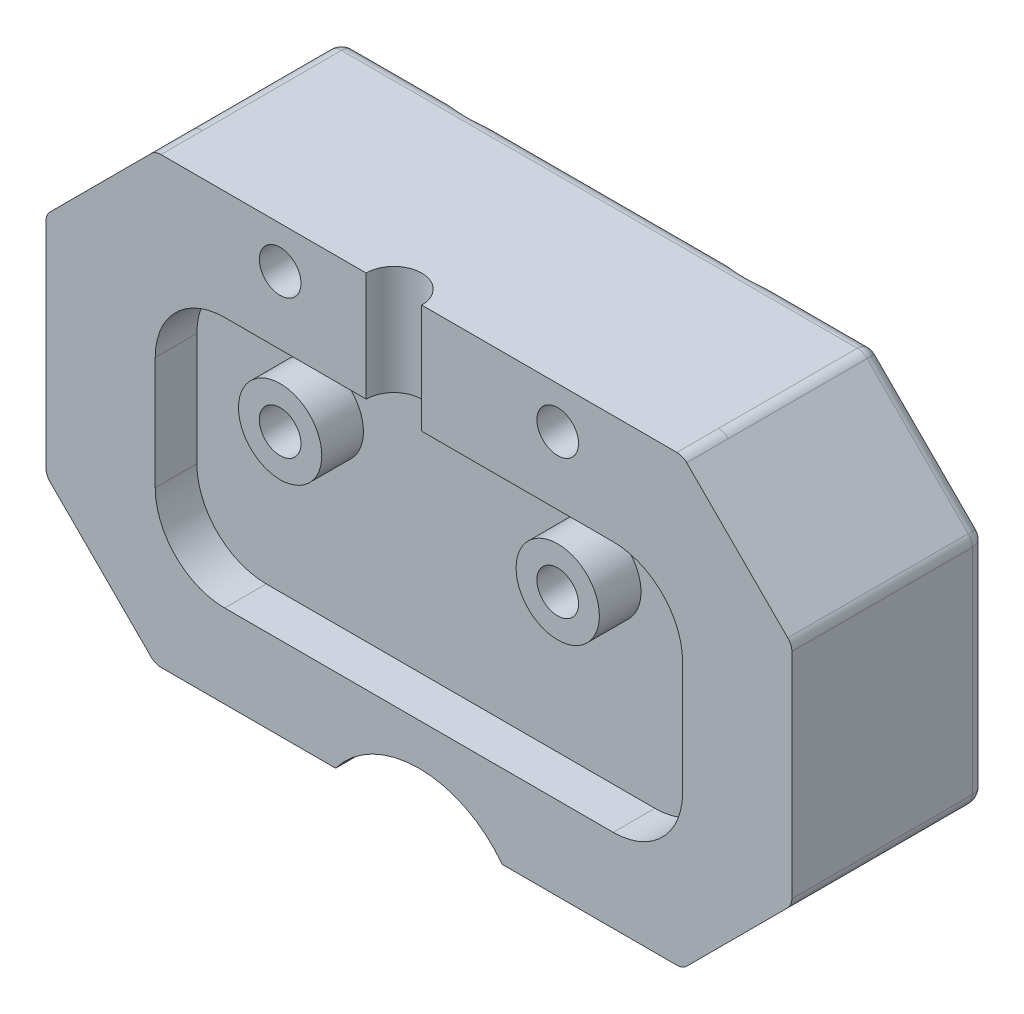
from build123d import *

# Parameters (mm, degrees)
CROQUIS3_W                   = 38
CROQUIS3_H                   = 38
SALIENTE_EXTRUIR9_DEPTH      = 1
SALIENTE_EXTRUIR10_START     = -11
SALIENTE_EXTRUIR10_OUTLINE_W = 38
SALIENTE_EXTRUIR10_OUTLINE_H = 38
SALIENTE_EXTRUIR10_DEPTH     = 10
CROQUIS13_W                  = 38
CROQUIS13_H                  = 38
SALIENTE_EXTRUIR15_DEPTH     = 3
CROQUIS14_R                  = 1.5
CORTAR_EXTRUIR1_DEPTH        = 14
CROQUIS15_W                  = 38
CROQUIS15_H                  = 24.129942315
CROQUIS15_R                  = 3.5
SALIENTE_EXTRUIR16_DEPTH     = 1
CORTAR_EXTRUIR2_DEPTH        = 14
SALIENTE_EXTRUIR17_DEPTH     = 5
SALIENTE_EXTRUIR18_DEPTH     = 5
CORTAR_EXTRUIR3_DEPTH        = 3
REDONDEO11_R                 = 1
CROQUIS21_R                  = 1.5
CORTAR_EXTRUIR4_DEPTH        = 11
SALIENTE_EXTRUIR20_START     = 3
CROQUIS22_R                  = 3
CROQUIS22_R_2                = 1.5
SALIENTE_EXTRUIR20_DEPTH     = 3
CHAFL_N1_SIZE                = 2
REDONDEO12_R                 = 1
REDONDEO13_R                 = 1
SALIENTE_EXTRUIR22_DEPTH     = 3
REDONDEO14_R                 = 5
SALIENTE_EXTRUIR23_DEPTH     = 8


# Read off the part's stored shape, not the designer's step: Saliente-Extruir10
with BuildPart() as part:
    # Croquis3 → Saliente-Extruir9 (new body)
    with BuildSketch(Plane.XY.offset(5)):
        Polygon((19, -5.370057685), (26.870057685, 2.5), (26.870057685, 40.5), (19, 48.370057685), (-19, 48.370057685), (-26.870057685, 40.5), (-26.870057685, 2.5), (-19, -5.370057685), align=None)
        with Locations((0, 21.5)):
            Rectangle(CROQUIS3_W, CROQUIS3_H, mode=Mode.SUBTRACT)
    extrude(amount=-SALIENTE_EXTRUIR9_DEPTH)

    # Saliente-Extruir10 outline → Saliente-Extruir10 (add)
    with BuildSketch(Plane(origin=(0, 0, 4), x_dir=(-1, 0, 0), z_dir=(0, 0, -1)).offset(SALIENTE_EXTRUIR10_START)):
        Polygon((-26.870057685, 2.5), (-19, -5.370057685), (19, -5.370057685), (26.870057685, 2.5), (26.870057685, 40.5), (19, 48.370057685), (-19, 48.370057685), (-26.870057685, 40.5), align=None)
        with Locations((0, 21.5)):
            Rectangle(SALIENTE_EXTRUIR10_OUTLINE_W, SALIENTE_EXTRUIR10_OUTLINE_H, mode=Mode.SUBTRACT)
    extrude(amount=SALIENTE_EXTRUIR10_DEPTH)

    # Croquis13 → Saliente-Extruir15 (add)
    with BuildSketch(Plane.XY.offset(15)):
        with BuildLine():
            Line((-22.5, 44.870057685), (-22.5, -1))
            Line((-22.5, -1), (22.5, -1))
            Line((22.5, -1), (22.5, 44.870057685))
            Line((22.5, 44.870057685), (19.292893219, 48.077164466))
            ThreePointArc((19.292893219, 48.077164466), (18.96846987, 48.293937218), (18.585786438, 48.370057685))
            Line((18.585786438, 48.370057685), (-18.585786438, 48.370057685))
            ThreePointArc((-18.585786438, 48.370057685), (-18.96846987, 48.293937218), (-19.292893219, 48.077164466))
            Line((-19.292893219, 48.077164466), (-22.5, 44.870057685))
        make_face()
        with Locations((0, 21.5)):
            Rectangle(CROQUIS13_W, CROQUIS13_H, mode=Mode.SUBTRACT)
    extrude(amount=SALIENTE_EXTRUIR15_DEPTH)

    # Croquis14 → Cortar-Extruir1 (cut)
    with BuildSketch(Plane(origin=(0, 0, 4), x_dir=(-1, 0, 0), z_dir=(0, 0, -1))):
        with Locations((10, 45.37415474)):
            Circle(CROQUIS14_R)
        with Locations(Location((-10, 45.37415474, 0), (0, 0, 180))):
            Circle(CROQUIS14_R)
    extrude(amount=-CORTAR_EXTRUIR1_DEPTH, mode=Mode.SUBTRACT)

    # Croquis15 → Saliente-Extruir16 (add)
    with BuildSketch(Plane(origin=(0, 0, 4), x_dir=(-1, 0, 0), z_dir=(0, 0, -1))):
        with Locations((0, 28.435028843)):
            Rectangle(CROQUIS15_W, CROQUIS15_H)
        with Locations((0, 25.370057685)):
            Circle(CROQUIS15_R, mode=Mode.SUBTRACT)
    extrude(amount=-SALIENTE_EXTRUIR16_DEPTH)

    # Croquis16 → Cortar-Extruir2 (cut)
    with BuildSketch(Plane(origin=(0, 0, 4), x_dir=(-1, 0, 0), z_dir=(0, 0, -1))):
        Polygon((-19, 2.5), (-19, 16.370057685), (-26.870057685, 24.24011537), (-26.870057685, 2.5), (-19, -5.370057685), (19, -5.370057685), (26.870057685, 2.5), (26.870057685, 24.24011537), (19, 16.370057685), (19, 2.5), align=None)
    extrude(amount=-CORTAR_EXTRUIR2_DEPTH, mode=Mode.SUBTRACT)

    # Croquis17 → Saliente-Extruir17 (add)
    with BuildSketch(Plane.XY.offset(5)):
        Polygon((6, 31.370057685), (6, 25.370057685), (6, 19.370057685), (6, 16.370057685), (19, 16.370057685), (19, 40.5), (-19, 40.5), (-19, 16.370057685), (-6, 16.370057685), (-6, 19.370057685), (-6, 31.370057685), align=None)
    extrude(amount=SALIENTE_EXTRUIR17_DEPTH)

    # Croquis18 → Saliente-Extruir18 (add)
    with BuildSketch(Plane.XY.offset(10)):
        Polygon((-19, 40.5), (-19, 16.370057685), (-6, 16.370057685), (-6, 19.370057685), (6, 19.370057685), (6, 16.370057685), (19, 16.370057685), (19, 40.5), align=None)
    extrude(amount=SALIENTE_EXTRUIR18_DEPTH)

    # Croquis19 → Cortar-Extruir3 (cut)
    with BuildSketch(Plane.XY.offset(18)):
        Polygon((-22.5, 19.870057685), (-19, 16.370057685), (-19, 21.370057685), (-22.5, 21.370057685), align=None)
        Polygon((19, 16.370057685), (22.5, 19.870057685), (22.5, 21.370057685), (19, 21.370057685), align=None)
    extrude(amount=-CORTAR_EXTRUIR3_DEPTH, mode=Mode.SUBTRACT)

    # Redondeo11
    redondeo11_edges = [part.edges().sort_by_distance(p)[0] for p in [
        (26.870057685, 40.5, 10),
        (19, 48.370057685, 10),
        (-19, 48.370057685, 10),
        (-26.870057685, 40.5, 10),
        (26.870057685, 24.24011537, 9.5),
        (19, 16.370057685, 9.5),
        (-26.870057685, 24.24011537, 9.5),
        (-19, 16.370057685, 9.5),
    ]]
    fillet(redondeo11_edges, radius=REDONDEO11_R)

    # Croquis21 → Cortar-Extruir4 (cut)
    with BuildSketch(Plane.XY.offset(15)):
        with Locations((-10, 35.37415474)):
            Circle(CROQUIS21_R)
        with Locations((10, 35.37415474)):
            Circle(CROQUIS21_R)
    extrude(amount=-CORTAR_EXTRUIR4_DEPTH, mode=Mode.SUBTRACT)

    # Croquis22 → Saliente-Extruir20 (add)
    # profile 1 of 2: a face of its own
    with BuildSketch(Plane.XY.offset(15).offset(SALIENTE_EXTRUIR20_START)):
        with Locations(Location((-10, 35.37415474, 0), (0, 0, 180))):
            Circle(CROQUIS22_R)
        with Locations((-10, 35.37415474)):
            Circle(CROQUIS22_R_2, mode=Mode.SUBTRACT)
    # profile 2 of 2: a face of its own
    with BuildSketch(Plane.XY.offset(15).offset(SALIENTE_EXTRUIR20_START)):
        with Locations(Location((10, 35.37415474, 0), (0, 0, 180))):
            Circle(CROQUIS22_R)
        with Locations((10, 35.37415474)):
            Circle(CROQUIS22_R_2, mode=Mode.SUBTRACT)
    extrude(amount=-SALIENTE_EXTRUIR20_DEPTH)

    # Croquis23 → Cortar-Revolución1 (revolve, cut)
    with BuildSketch(Plane.XY.offset(18)):
        Polygon((-1.8, 48.370057685), (-1.8, 44.97415474), (-1.8, 40.5), (0.2, 40.5), (0.2, 48.370057685), align=None)
    revolve(axis=Axis((-1.8, 44.97415474, 18), (0, 1, 0)), mode=Mode.SUBTRACT)

    # Chaflán1
    # the kernel refuses this chamfer: 2 mm, written as the material it takes off along each edge
    with BuildSketch(Plane(origin=(-10, 45.37415474, 4), x_dir=(-1, 0, 0), z_dir=(0, -1, 0))) as chafl_n1_piece_1:
        Polygon((1.5 + CHAFL_N1_SIZE, 0), (1.5, -CHAFL_N1_SIZE), (1.5, 0), align=None)
    revolve(axis=Axis((-10, 45.37415474, 4), (0, 0, -1)), mode=Mode.SUBTRACT)
    with BuildSketch(Plane(origin=(10, 45.37415474, 4), x_dir=(1, 0, 0), z_dir=(0, 1, 0))) as chafl_n1_piece_2:
        Polygon((1.5 + CHAFL_N1_SIZE, 0), (1.5, -CHAFL_N1_SIZE), (1.5, 0), align=None)
    revolve(axis=Axis((10, 45.37415474, 4), (0, 0, -1)), mode=Mode.SUBTRACT)
    with BuildSketch(Plane(origin=(-10, 35.37415474, 4), x_dir=(1, 0, 0), z_dir=(0, -1, 0))) as chafl_n1_piece_3:
        Polygon((1.5 + CHAFL_N1_SIZE, 0), (1.5, CHAFL_N1_SIZE), (1.5, 0), align=None)
    revolve(axis=Axis((-10, 35.37415474, 4), (0, 0, 1)), mode=Mode.SUBTRACT)
    with BuildSketch(Plane(origin=(10, 35.37415474, 4), x_dir=(1, 0, 0), z_dir=(0, -1, 0))) as chafl_n1_piece_4:
        Polygon((1.5 + CHAFL_N1_SIZE, 0), (1.5, CHAFL_N1_SIZE), (1.5, 0), align=None)
    revolve(axis=Axis((10, 35.37415474, 4), (0, 0, 1)), mode=Mode.SUBTRACT)

    # Redondeo12
    # the kernel refuses this fillet: 1 mm, written as the material it takes off along each edge
    with BuildSketch(Plane(origin=(26.870057685, 24.654328933, 4), x_dir=(-1, 0, 0), z_dir=(0, 1, 0)), Plane(origin=(-26.870057685, 40.085786438, 4), x_dir=(1, 0, 0), z_dir=(0, -1, 0))) as redondeo12_piece_1:
        with BuildLine():
            CenterArc((REDONDEO12_R, REDONDEO12_R), REDONDEO12_R, 180, 90)
            Line((0, REDONDEO12_R), (0, 0))
            Line((0, 0), (REDONDEO12_R, 0))
        make_face()
    extrude(amount=15.431457505, mode=Mode.SUBTRACT)
    with BuildSketch(Plane(origin=(26.577164466, 40.792893219, 4), x_dir=(-0.7071067811865461, -0.707106781186549, 0), z_dir=(-0.707106781186549, 0.7071067811865461, 0)), Plane(origin=(-26.577164466, 23.947222151, 4), x_dir=(0.7071067811865487, 0.7071067811865465, 0), z_dir=(0.7071067811865465, -0.7071067811865487, 0)), Plane(origin=(-19.292893219, 48.077164466, 4), x_dir=(0.7071067811865487, -0.7071067811865465, 0), z_dir=(-0.7071067811865465, -0.7071067811865487, 0)), Plane(origin=(19.292893219, 16.662950904, 4), x_dir=(-0.7071067811865485, 0.7071067811865467, 0), z_dir=(0.7071067811865466, 0.7071067811865485, 0))) as redondeo12_piece_2:
        with BuildLine():
            CenterArc((REDONDEO12_R, REDONDEO12_R), REDONDEO12_R, 180, 90)
            Line((0, REDONDEO12_R), (0, 0))
            Line((0, 0), (REDONDEO12_R, 0))
        make_face()
    extrude(amount=10.30151519, mode=Mode.SUBTRACT)
    with BuildSketch(Plane(origin=(18.585786438, 48.370057685, 4), x_dir=(0, -1, 0), z_dir=(-1, 0, 0)), Plane(origin=(-9.309576067, 48.370057685, 4), x_dir=(0, -1, 0), z_dir=(-1, 0, 0))) as redondeo12_piece_3:
        with BuildLine():
            CenterArc((REDONDEO12_R, REDONDEO12_R), REDONDEO12_R, 180, 90)
            Line((0, REDONDEO12_R), (0, 0))
            Line((0, 0), (REDONDEO12_R, 0))
        make_face()
    extrude(amount=9.276210371, mode=Mode.SUBTRACT)
    with BuildSketch(Plane(origin=(18.585786438, 16.370057685, 4), x_dir=(0, 1, 0), z_dir=(-1, 0, 0))) as redondeo12_piece_4:
        with BuildLine():
            CenterArc((REDONDEO12_R, -REDONDEO12_R), REDONDEO12_R, 90, 90)
            Line((0, -REDONDEO12_R), (0, 0))
            Line((0, 0), (REDONDEO12_R, 0))
        make_face()
    extrude(amount=37.171572875, mode=Mode.SUBTRACT)
    with BuildSketch(Plane(origin=(-18.585786438, 17.370057685, 4), x_dir=(-0.7071067811865493, -0.7071067811865458, 0), z_dir=(-0.7071067811865458, 0.7071067811865493, 0))) as redondeo12_piece_5:
        with BuildLine():
            CenterArc((1 - REDONDEO12_R, REDONDEO12_R), REDONDEO12_R, 270, 90)
            Line((1, REDONDEO12_R), (1, 0))
            Line((1, 0), (1 - REDONDEO12_R, 0))
        make_face()
    revolve(axis=Axis((-18.585786438, 17.370057685, 4), (0, 0, 1)), revolution_arc=45, mode=Mode.SUBTRACT)
    with BuildSketch(Plane(origin=(-25.870057685, 24.654328933, 4), x_dir=(-1, 0, 0), z_dir=(0, 1, 0))) as redondeo12_piece_6:
        with BuildLine():
            CenterArc((1 - REDONDEO12_R, REDONDEO12_R), REDONDEO12_R, 270, 90)
            Line((1, REDONDEO12_R), (1, 0))
            Line((1, 0), (1 - REDONDEO12_R, 0))
        make_face()
    revolve(axis=Axis((-25.870057685, 24.654328933, 4), (0, 0, 1)), revolution_arc=45, mode=Mode.SUBTRACT)
    with BuildSketch(Plane(origin=(18.585786438, 17.370057685, 4), x_dir=(0, -1, 0), z_dir=(-1, 0, 0))) as redondeo12_piece_7:
        with BuildLine():
            CenterArc((1 - REDONDEO12_R, REDONDEO12_R), REDONDEO12_R, 270, 90)
            Line((1, REDONDEO12_R), (1, 0))
            Line((1, 0), (1 - REDONDEO12_R, 0))
        make_face()
    revolve(axis=Axis((18.585786438, 17.370057685, 4), (0, 0, 1)), revolution_arc=45, mode=Mode.SUBTRACT)
    with BuildSketch(Plane(origin=(25.870057685, 24.654328933, 4), x_dir=(1, 0, 0), z_dir=(0, 1, 0))) as redondeo12_piece_8:
        with BuildLine():
            CenterArc((1 - REDONDEO12_R, -REDONDEO12_R), REDONDEO12_R, 0, 90)
            Line((1, -REDONDEO12_R), (1, 0))
            Line((1, 0), (1 - REDONDEO12_R, 0))
        make_face()
    revolve(axis=Axis((25.870057685, 24.654328933, 4), (0, 0, -1)), revolution_arc=45, mode=Mode.SUBTRACT)
    with BuildSketch(Plane(origin=(-25.870057685, 40.085786438, 4), x_dir=(-0.7071067811865493, 0.7071067811865458, 0), z_dir=(0.7071067811865458, 0.7071067811865493, 0))) as redondeo12_piece_9:
        with BuildLine():
            CenterArc((1 - REDONDEO12_R, REDONDEO12_R), REDONDEO12_R, 270, 90)
            Line((1, REDONDEO12_R), (1, 0))
            Line((1, 0), (1 - REDONDEO12_R, 0))
        make_face()
    revolve(axis=Axis((-25.870057685, 40.085786438, 4), (0, 0, 1)), revolution_arc=45, mode=Mode.SUBTRACT)
    with BuildSketch(Plane(origin=(-18.585786438, 47.370057685, 4), x_dir=(0, 1, 0), z_dir=(1, 0, 0))) as redondeo12_piece_10:
        with BuildLine():
            CenterArc((1 - REDONDEO12_R, REDONDEO12_R), REDONDEO12_R, 270, 90)
            Line((1, REDONDEO12_R), (1, 0))
            Line((1, 0), (1 - REDONDEO12_R, 0))
        make_face()
    revolve(axis=Axis((-18.585786438, 47.370057685, 4), (0, 0, 1)), revolution_arc=45, mode=Mode.SUBTRACT)
    with BuildSketch(Plane(origin=(18.585786438, 47.370057685, 4), x_dir=(0.7071067811865476, 0.7071067811865476, 0), z_dir=(0.7071067811865476, -0.7071067811865476, 0))) as redondeo12_piece_11:
        with BuildLine():
            CenterArc((1 - REDONDEO12_R, REDONDEO12_R), REDONDEO12_R, 270, 90)
            Line((1, REDONDEO12_R), (1, 0))
            Line((1, 0), (1 - REDONDEO12_R, 0))
        make_face()
    revolve(axis=Axis((18.585786438, 47.370057685, 4), (0, 0, 1)), revolution_arc=45, mode=Mode.SUBTRACT)
    with BuildSketch(Plane(origin=(25.870057685, 40.085786438, 4), x_dir=(1, 0, 0), z_dir=(0, -1, 0))) as redondeo12_piece_12:
        with BuildLine():
            CenterArc((1 - REDONDEO12_R, REDONDEO12_R), REDONDEO12_R, 270, 90)
            Line((1, REDONDEO12_R), (1, 0))
            Line((1, 0), (1 - REDONDEO12_R, 0))
        make_face()
    revolve(axis=Axis((25.870057685, 40.085786438, 4), (0, 0, 1)), revolution_arc=45, mode=Mode.SUBTRACT)
    with BuildSketch(Plane(origin=(10.690423933, 48.370057685, 4), x_dir=(0, -1, 0), z_dir=(-1, 0, 0))) as redondeo12_piece_13:
        with BuildLine():
            CenterArc((REDONDEO12_R, REDONDEO12_R), REDONDEO12_R, 180, 90)
            Line((0, REDONDEO12_R), (0, 0))
            Line((0, 0), (REDONDEO12_R, 0))
        make_face()
    extrude(amount=21.380847867, mode=Mode.SUBTRACT)

    # Redondeo13
    redondeo13_edges = [part.edges().sort_by_distance(p)[0] for p in [
        (22.5, 21.370057685, 16.5),
        (19, 21.370057685, 16.5),
        (-19, 21.370057685, 16.5),
        (-22.5, 21.370057685, 16.5),
    ]]
    fillet(redondeo13_edges, radius=REDONDEO13_R)

    # Croquis26 → Saliente-Extruir22 (add)
    with BuildSketch(Plane.XY.offset(15)):
        with BuildLine():
            Line((19, 22.370057685), (-19, 22.370057685))
            ThreePointArc((-19, 22.370057685), (-19.292893219, 21.662950904), (-20, 21.370057685))
            Line((-20, 21.370057685), (-21.5, 21.370057685))
            ThreePointArc((-21.5, 21.370057685), (-22.207106781, 21.662950904), (-22.5, 22.370057685))
            Line((-22.5, 22.370057685), (-22.5, 44.870057685))
            Line((-22.5, 44.870057685), (-26.577164466, 40.792893219))
            ThreePointArc((-26.577164466, 40.792893219), (-26.793937218, 40.46846987), (-26.870057685, 40.085786438))
            Line((-26.870057685, 40.085786438), (-26.870057685, 24.654328933))
            ThreePointArc((-26.870057685, 24.654328933), (-26.793937218, 24.2716455), (-26.577164466, 23.947222151))
            Line((-26.577164466, 23.947222151), (-19.292893219, 16.662950904))
            ThreePointArc((-19.292893219, 16.662950904), (-18.96846987, 16.446178153), (-18.585786438, 16.370057685))
            Line((-18.585786438, 16.370057685), (-6, 16.370057685))
            Line((-6, 16.370057685), (-6, 19.370057685))
            Line((-6, 19.370057685), (6, 19.370057685))
            Line((6, 19.370057685), (6, 16.370057685))
            Line((6, 16.370057685), (18.585786438, 16.370057685))
            ThreePointArc((18.585786438, 16.370057685), (18.96846987, 16.446178153), (19.292893219, 16.662950904))
            Line((19.292893219, 16.662950904), (26.577164466, 23.947222151))
            ThreePointArc((26.577164466, 23.947222151), (26.793937218, 24.2716455), (26.870057685, 24.654328933))
            Line((26.870057685, 24.654328933), (26.870057685, 40.085786438))
            ThreePointArc((26.870057685, 40.085786438), (26.793937218, 40.46846987), (26.577164466, 40.792893219))
            Line((26.577164466, 40.792893219), (22.5, 44.870057685))
            Line((22.5, 44.870057685), (22.5, 22.370057685))
            ThreePointArc((22.5, 22.370057685), (22.207106781, 21.662950904), (21.5, 21.370057685))
            Line((21.5, 21.370057685), (20, 21.370057685))
            ThreePointArc((20, 21.370057685), (19.292893219, 21.662950904), (19, 22.370057685))
        make_face()
    extrude(amount=SALIENTE_EXTRUIR22_DEPTH)

    # Redondeo14
    redondeo14_edges = [part.edges().sort_by_distance(p)[0] for p in [
        (-19, 40.5, 16.5),
        (19, 40.5, 16.5),
        (19, 22.370057685, 16.5),
        (-19, 22.370057685, 16.5),
    ]]
    fillet(redondeo14_edges, radius=REDONDEO14_R)

    # Croquis27 → Saliente-Extruir23 (add)
    with BuildSketch(Plane.XY.offset(18)):
        with BuildLine():
            ThreePointArc((-6, 16.370057685), (-3.354101966, 18.578261618), (0, 19.370057685))
            Line((0, 19.370057685), (-6, 19.370057685))
            Line((-6, 19.370057685), (-6, 16.370057685))
        make_face()
        with BuildLine():
            ThreePointArc((0, 19.370057685), (3.354101966, 18.578261618), (6, 16.370057685))
            Line((6, 16.370057685), (6, 19.370057685))
            Line((6, 19.370057685), (0, 19.370057685))
        make_face()
    extrude(amount=-SALIENTE_EXTRUIR23_DEPTH)


solid = part.part
